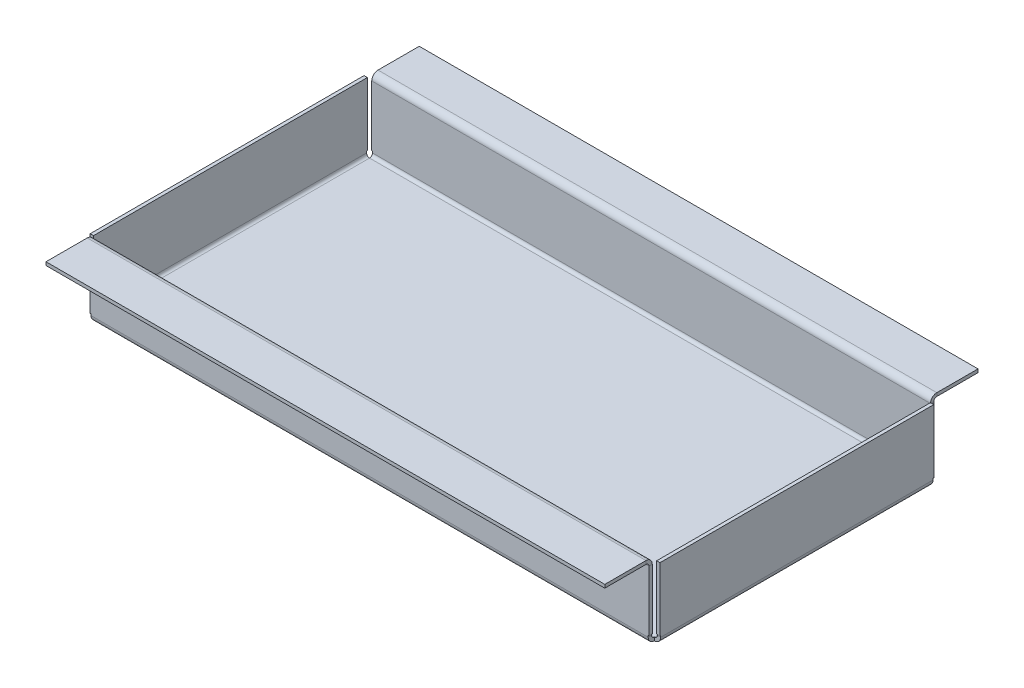
from build123d import *

# Parameters (mm, degrees)
SKETCH1_W                      = 152.4
SKETCH1_H                      = 76.2
BOSS_EXTRUDE1_DEPTH            = 19.05
CONVERT_SOLID1_START           = -74.5236
CONVERT_SOLID1_DEPTH           = 72.8472
CONVERT_SOLID1_START_2         = -77
CONVERT_SOLID1_2_DEPTH         = 2.273736392
CONVERT_SOLID1_START_3         = -1.473736392
CONVERT_SOLID1_3_DEPTH         = 2.473736392
CONVERT_SOLID1_START_4         = -74.726263608
CONVERT_SOLID1_4_DEPTH         = 73.252527216
CONVERT_SOLID1_5_DEPTH         = 0.202663608
CONVERT_SOLID1_START_5         = -1.6764
CONVERT_SOLID1_6_DEPTH         = 0.202663608
CONVERT_SOLID1_START_6         = 1.473736392
CONVERT_SOLID1_7_DEPTH         = 149.452527216
EDGE_FLANGE1_STRIP_W           = 5.1308
EDGE_FLANGE1_STRIP_H           = 0.889
EDGE_FLANGE1_STRIP_CUT_DEPTH   = 149.452527217
EDGE_FLANGE1_STRIP_2_W         = 5.1308
EDGE_FLANGE1_STRIP_2_H         = 0.889
EDGE_FLANGE1_STRIP_CUT_2_DEPTH = 149.452527217
EDGE_FLANGE1_DEPTH             = 149.452527217
EDGE_FLANGE1_BEND_DEPTH        = 149.452527217


with BuildPart() as part:
    # Sketch1 → Boss-Extrude1 (new body)
    with BuildSketch(Plane(origin=(0, 0, 0), x_dir=(1, 0, 0), z_dir=(0, 1, 0))):
        with Locations((76.2, 38.1)):
            Rectangle(SKETCH1_W, SKETCH1_H)
    extrude(amount=BOSS_EXTRUDE1_DEPTH)

    # Convert-Solid1: read off the stored shape, not the designer's step
    # Convert-Solid1 outline → Convert-Solid1 (cut)
    with BuildSketch(Plane.XY.offset(CONVERT_SOLID1_START)):
        with BuildLine():
            Line((151.511, 19.05), (0.889, 19.05))
            Line((0.889, 19.05), (0.889, 1.6764))
            ThreePointArc((0.889, 1.6764), (1.11962412, 1.11962412), (1.6764, 0.889))
            Line((1.6764, 0.889), (150.7236, 0.889))
            ThreePointArc((150.7236, 0.889), (151.28037588, 1.11962412), (151.511, 1.6764))
            Line((151.511, 1.6764), (151.511, 19.05))
        make_face()
        with BuildLine():
            ThreePointArc((152.4, 1.6764), (151.908993808, 0.491006192), (150.7236, 0))
            Line((150.7236, 0), (152.4, 0))
            Line((152.4, 0), (152.4, 1.6764))
        make_face()
        with BuildLine():
            Line((0, 0), (1.6764, 0))
            ThreePointArc((1.6764, 0), (0.491006192, 0.491006192), (0, 1.6764))
            Line((0, 1.6764), (0, 0))
        make_face()
    extrude(amount=CONVERT_SOLID1_DEPTH, mode=Mode.SUBTRACT)

    # Convert-Solid1 2 outline → Convert-Solid1 2 (cut)
    with BuildSketch(Plane.XY.offset(CONVERT_SOLID1_START_2)):
        Polygon((150.926263608, 2.11106664), (150.7236, 2.11106664), (150.7236, 0), (152.4, 0), (152.4, 19.05), (150.926263608, 19.05), align=None)
        Polygon((1.473736392, 19.05), (0, 19.05), (0, 0), (1.6764, 0), (1.6764, 2.11106664), (1.473736392, 2.11106664), align=None)
    extrude(amount=CONVERT_SOLID1_2_DEPTH, mode=Mode.SUBTRACT)

    # Convert-Solid1 3 outline → Convert-Solid1 3 (cut)
    with BuildSketch(Plane.XY.offset(CONVERT_SOLID1_START_3)):
        Polygon((150.926263608, 2.11106664), (150.7236, 2.11106664), (150.7236, 0), (152.4, 0), (152.4, 19.05), (150.926263608, 19.05), align=None)
        Polygon((1.473736392, 19.05), (0, 19.05), (0, 0), (1.6764, 0), (1.6764, 2.11106664), (1.473736392, 2.11106664), align=None)
    extrude(amount=CONVERT_SOLID1_3_DEPTH, mode=Mode.SUBTRACT)

    # Convert-Solid1 4 outline → Convert-Solid1 4 (cut)
    with BuildSketch(Plane.XY.offset(CONVERT_SOLID1_START_4)):
        with BuildLine():
            Line((150.926263608, 2.11106664), (150.7236, 2.11106664))
            Line((150.7236, 2.11106664), (150.7236, 0.889))
            ThreePointArc((150.7236, 0.889), (151.28037588, 1.11962412), (151.511, 1.6764))
            Line((151.511, 1.6764), (151.511, 19.05))
            Line((151.511, 19.05), (150.926263608, 19.05))
            Line((150.926263608, 19.05), (150.926263608, 2.11106664))
        make_face()
        with BuildLine():
            ThreePointArc((152.4, 1.6764), (151.908993808, 0.491006192), (150.7236, 0))
            Line((150.7236, 0), (152.4, 0))
            Line((152.4, 0), (152.4, 1.6764))
        make_face()
        with BuildLine():
            ThreePointArc((0.889, 1.6764), (1.11962412, 1.11962412), (1.6764, 0.889))
            Line((1.6764, 0.889), (1.6764, 2.11106664))
            Line((1.6764, 2.11106664), (1.473736392, 2.11106664))
            Line((1.473736392, 2.11106664), (1.473736392, 19.05))
            Line((1.473736392, 19.05), (0.889, 19.05))
            Line((0.889, 19.05), (0.889, 1.6764))
        make_face()
        with BuildLine():
            Line((0, 0), (1.6764, 0))
            ThreePointArc((1.6764, 0), (0.491006192, 0.491006192), (0, 1.6764))
            Line((0, 1.6764), (0, 0))
        make_face()
    extrude(amount=CONVERT_SOLID1_4_DEPTH, mode=Mode.SUBTRACT)

    # Convert-Solid1 5 outline → Convert-Solid1 5 (cut)
    with BuildSketch(Plane.XY.offset(CONVERT_SOLID1_START_4)):
        with BuildLine():
            ThreePointArc((151.511, 1.6764), (151.28037588, 1.11962412), (150.7236, 0.889))
            Line((150.7236, 0.889), (150.7236, 0))
            ThreePointArc((150.7236, 0), (151.908993808, 0.491006192), (152.4, 1.6764))
            Line((152.4, 1.6764), (152.4, 2.11106664))
            Line((152.4, 2.11106664), (151.511, 2.11106664))
            Line((151.511, 2.11106664), (151.511, 1.6764))
        make_face()
        with BuildLine():
            Line((1.6764, 0), (1.6764, 0.889))
            ThreePointArc((1.6764, 0.889), (1.11962412, 1.11962412), (0.889, 1.6764))
            Line((0.889, 1.6764), (0.889, 2.11106664))
            Line((0.889, 2.11106664), (0, 2.11106664))
            Line((0, 2.11106664), (0, 1.6764))
            ThreePointArc((0, 1.6764), (0.491006192, 0.491006192), (1.6764, 0))
        make_face()
    extrude(amount=CONVERT_SOLID1_5_DEPTH, mode=Mode.SUBTRACT)

    # Convert-Solid1 6 outline → Convert-Solid1 6 (cut)
    with BuildSketch(Plane.XY.offset(CONVERT_SOLID1_START_5)):
        with BuildLine():
            ThreePointArc((151.511, 1.6764), (151.28037588, 1.11962412), (150.7236, 0.889))
            Line((150.7236, 0.889), (150.7236, 0))
            ThreePointArc((150.7236, 0), (151.908993808, 0.491006192), (152.4, 1.6764))
            Line((152.4, 1.6764), (152.4, 2.11106664))
            Line((152.4, 2.11106664), (151.511, 2.11106664))
            Line((151.511, 2.11106664), (151.511, 1.6764))
        make_face()
        with BuildLine():
            Line((1.6764, 0), (1.6764, 0.889))
            ThreePointArc((1.6764, 0.889), (1.11962412, 1.11962412), (0.889, 1.6764))
            Line((0.889, 1.6764), (0.889, 2.11106664))
            Line((0.889, 2.11106664), (0, 2.11106664))
            Line((0, 2.11106664), (0, 1.6764))
            ThreePointArc((0, 1.6764), (0.491006192, 0.491006192), (1.6764, 0))
        make_face()
    extrude(amount=CONVERT_SOLID1_6_DEPTH, mode=Mode.SUBTRACT)

    # Convert-Solid1 7 outline → Convert-Solid1 7 (cut)
    with BuildSketch(Plane.YZ.offset(CONVERT_SOLID1_START_6)):
        with BuildLine():
            Line((0, 0), (0, -1.6764))
            ThreePointArc((0, -1.6764), (0.491006192, -0.491006192), (1.6764, 0))
            Line((1.6764, 0), (0, 0))
        make_face()
        with BuildLine():
            ThreePointArc((1.6764, -76.2), (0.491006192, -75.708993808), (0, -74.5236))
            Line((0, -74.5236), (0, -76.2))
            Line((0, -76.2), (1.6764, -76.2))
        make_face()
        with BuildLine():
            Line((19.05, -74.5236), (0.889, -74.5236))
            ThreePointArc((0.889, -74.5236), (1.11962412, -75.08037588), (1.6764, -75.311))
            Line((1.6764, -75.311), (19.05, -75.311))
            Line((19.05, -75.311), (19.05, -74.5236))
        make_face()
        with BuildLine():
            Line((0.889, -1.6764), (19.05, -1.6764))
            Line((19.05, -1.6764), (19.05, -0.889))
            Line((19.05, -0.889), (1.6764, -0.889))
            ThreePointArc((1.6764, -0.889), (1.11962412, -1.11962412), (0.889, -1.6764))
        make_face()
    extrude(amount=CONVERT_SOLID1_7_DEPTH, mode=Mode.SUBTRACT)

    # Edge-Flange1: sheet metal written as solids
    # Edge-Flange1 strip (on a plane across the edge) → Edge-Flange1 strip cut (cut)
    with BuildSketch(Plane(origin=(150.926263608, 19.05, 0), x_dir=(0, -1, 0), z_dir=(-1, 0, 0))):
        with Locations((-1.778, -0.4445)):
            Rectangle(EDGE_FLANGE1_STRIP_W, EDGE_FLANGE1_STRIP_H)
    extrude(amount=EDGE_FLANGE1_STRIP_CUT_DEPTH, mode=Mode.SUBTRACT)

    # Edge-Flange1 strip 2 (on a plane across the edge) → Edge-Flange1 strip cut 2 (cut)
    with BuildSketch(Plane(origin=(1.473736392, 19.05, -76.2), x_dir=(0, -1, 0), z_dir=(1, 0, 0))):
        with Locations((-1.778, -0.4445)):
            Rectangle(EDGE_FLANGE1_STRIP_2_W, EDGE_FLANGE1_STRIP_2_H)
    extrude(amount=EDGE_FLANGE1_STRIP_CUT_2_DEPTH, mode=Mode.SUBTRACT)

    # Edge-Flange1 section (on a plane across the edge) → Edge-Flange1 (add)
    with BuildSketch(Plane(origin=(150.926263608, 19.05, 0), x_dir=(0, -1, 0), z_dir=(-1, 0, 0))):
        with BuildLine():
            Line((-0.889, 0.7874), (-0.889, 11.811))
            Line((-0.889, 11.811), (0, 11.811))
            Line((0, 11.811), (0, 0.7874))
            ThreePointArc((0, 0.7874), (0.23062412, 0.23062412), (0.7874, 0))
            Line((0.7874, 0), (0.7874, -0.889))
            ThreePointArc((0.7874, -0.889), (-0.397993808, -0.397993808), (-0.889, 0.7874))
        make_face()
    extrude(amount=EDGE_FLANGE1_DEPTH)

    # Edge-Flange1 section 2 (on a plane across the edge) → Edge-Flange1 bend (add)
    with BuildSketch(Plane(origin=(1.473736392, 19.05, -76.2), x_dir=(0, -1, 0), z_dir=(1, 0, 0))):
        with BuildLine():
            Line((-0.889, 0.7874), (-0.889, 11.811))
            Line((-0.889, 11.811), (0, 11.811))
            Line((0, 11.811), (0, 0.7874))
            ThreePointArc((0, 0.7874), (0.23062412, 0.23062412), (0.7874, 0))
            Line((0.7874, 0), (0.7874, -0.889))
            ThreePointArc((0.7874, -0.889), (-0.397993808, -0.397993808), (-0.889, 0.7874))
        make_face()
    extrude(amount=EDGE_FLANGE1_BEND_DEPTH)


solid = part.part
